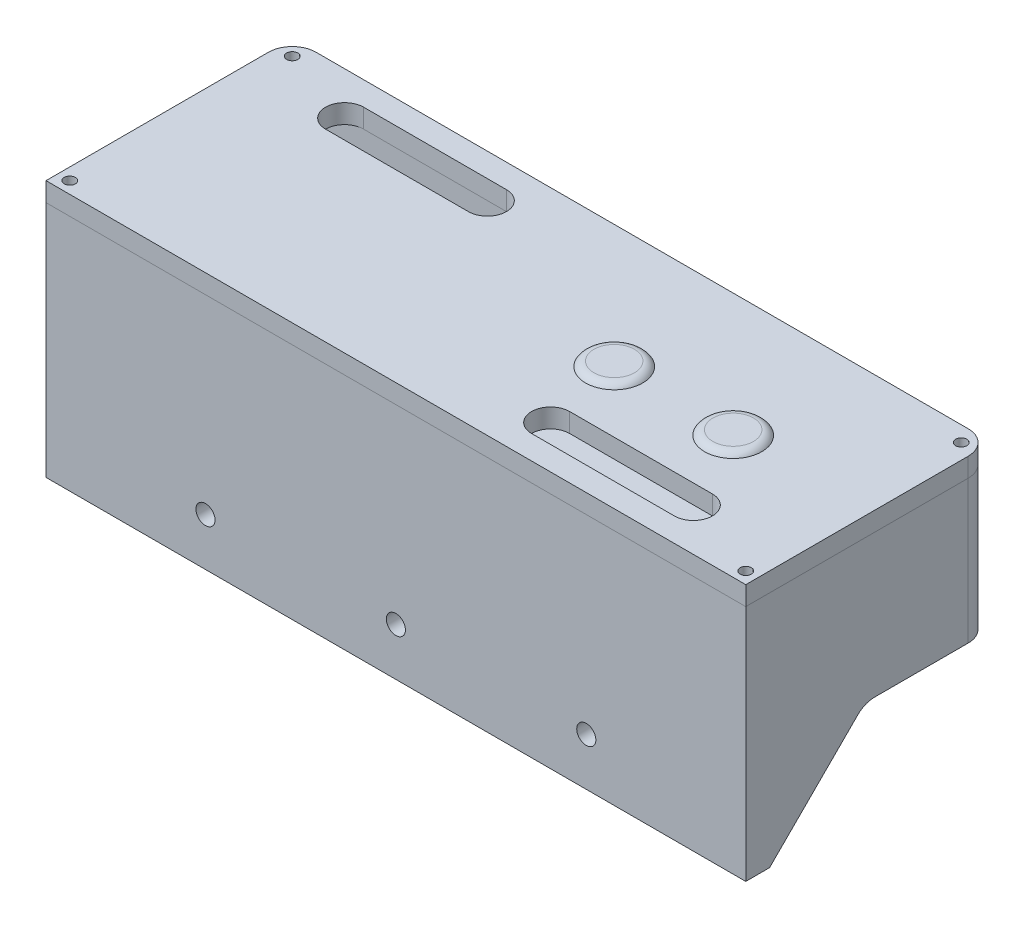
from build123d import *

# Parameters (mm, degrees)
SKETCH1_R             = 1.5
BOSS_EXTRUDE1_DEPTH   = 5.08
SKETCH1_3_R           = 1.5
SKETCH1_3_W           = 174
SKETCH1_3_H           = 53
BOSS_EXTRUDE2_DEPTH   = 38.1
SKETCH3_R             = 1.5
SKETCH3_R_2           = 6.35
BOSS_EXTRUDE4_DEPTH   = 5.08
BOSS_EXTRUDE5_DEPTH   = 25.4
CHAMFER1_SIZE         = 25.4
SKETCH7_R             = 2.55
CUT_EXTRUDE2_DEPTH    = 25.4
SKETCH8_R             = 6.249999997
BOSS_EXTRUDE6_DEPTH   = 2.54
BOSS_EXTRUDE6_2_DEPTH = 2.54
SKETCH8_4_R           = 7.62
SKETCH8_4_R_2         = 6.35
SKETCH8_4_R_3         = 6.249999997
BOSS_EXTRUDE7_DEPTH   = 1.27
FILLET1_R             = 2.54
FILLET2_R             = 2.54
FILLET3_START         = -93.35
FILLET3_DEPTH         = 6.35
FILLET3_START_2       = 87
FILLET3_2_DEPTH       = 6.35


with BuildPart() as part:
    # Sketch1 → Boss-Extrude1 (new body)
    with BuildSketch(Plane(origin=(0, 0, 0), x_dir=(1, 0, 0), z_dir=(0, 1, 0))):
        with BuildLine():
            Line((87, 32.85), (-87, 32.85))
            ThreePointArc((-87, 32.85), (-91.490128061, 30.990128061), (-93.35, 26.5))
            Line((-93.35, 26.5), (-93.35, -1.1))
            Line((-93.35, -1.1), (-87, -1.1))
            Line((-87, -1.1), (-87, -26.5))
            Line((-87, -26.5), (-89.114339828, -28.614339828))
            ThreePointArc((-89.114339828, -28.614339828), (-91.235660172, -28.614339828), (-91.235660172, -30.735660172))
            Line((-91.235660172, -30.735660172), (-93.35, -32.85))
            Line((-93.35, -32.85), (93.35, -32.85))
            Line((93.35, -32.85), (91.235660172, -30.735660172))
            ThreePointArc((91.235660172, -30.735660172), (91.235660172, -28.614339828), (89.114339828, -28.614339828))
            Line((89.114339828, -28.614339828), (87, -26.5))
            Line((87, -26.5), (87, -1.1))
            Line((87, -1.1), (93.35, -1.1))
            Line((93.35, -1.1), (93.35, 26.5))
            ThreePointArc((93.35, 26.5), (91.490128061, 30.990128061), (87, 32.85))
        make_face()
        with Locations(Location((-78.7, 0, 0), (0, 0, 270))):
            Circle(SKETCH1_R, mode=Mode.SUBTRACT)
        with Locations(Location((0, 0, 0), (0, 0, 270))):
            Circle(SKETCH1_R, mode=Mode.SUBTRACT)
        with Locations(Location((78.7, 0, 0), (0, 0, 270))):
            Circle(SKETCH1_R, mode=Mode.SUBTRACT)
    extrude(amount=BOSS_EXTRUDE1_DEPTH)

    # Sketch1<3> → Boss-Extrude2 (add)
    with BuildSketch(Plane(origin=(0, 0, 0), x_dir=(1, 0, 0), z_dir=(0, 1, 0))):
        with BuildLine():
            Line((-87, 32.85), (87, 32.85))
            ThreePointArc((87, 32.85), (91.490128061, 30.990128061), (93.35, 26.5))
            Line((93.35, 26.5), (93.35, -32.85))
            Line((93.35, -32.85), (-93.35, -32.85))
            Line((-93.35, -32.85), (-93.35, 26.5))
            ThreePointArc((-93.35, 26.5), (-91.490128061, 30.990128061), (-87, 32.85))
        make_face()
        with Locations(Location((-89.24506403, 28.74506403, 0), (0, 0, 90))):
            Circle(SKETCH1_3_R, mode=Mode.SUBTRACT)
        with Locations(Location((89.24506403, 28.74506403, 0), (0, 0, 90))):
            Circle(SKETCH1_3_R, mode=Mode.SUBTRACT)
        with Locations(Location((90.175, -29.675, 0), (0, 0, 90))):
            Circle(SKETCH1_3_R, mode=Mode.SUBTRACT)
        with Locations(Location((-90.175, -29.675, 0), (0, 0, 90))):
            Circle(SKETCH1_3_R, mode=Mode.SUBTRACT)
        Rectangle(SKETCH1_3_W, SKETCH1_3_H, mode=Mode.SUBTRACT)
    extrude(amount=BOSS_EXTRUDE2_DEPTH)

    # Sketch1<4> → Boss-Extrude5 (add)
    with BuildSketch(Plane(origin=(0, 0, 0), x_dir=(1, 0, 0), z_dir=(0, 1, 0))):
        Polygon((-87, -26.5), (-87, -1.1), (-93.35, -1.1), (-93.35, -32.85), (93.35, -32.85), (93.35, -1.1), (87, -1.1), (87, -26.5), align=None)
    extrude(amount=-BOSS_EXTRUDE5_DEPTH)

    # Chamfer1
    chamfer1_edges = [part.edges().sort_by_distance(p)[0] for p in [
        (-90.175, -25.4, 1.1),
        (90.175, -25.4, 1.1),
    ]]
    chamfer(chamfer1_edges, length=CHAMFER1_SIZE - 0.0001)  # a hair under: the kernel refuses the full size

    # Sketch7 → Cut-Extrude2 (cut)
    with BuildSketch(Plane(origin=(0, 0, 26.5), x_dir=(-1, 0, 0), z_dir=(0, 0, -1))):
        with Locations((-50.8, -12.7)):
            Circle(SKETCH7_R)
        with Locations((0, -12.7)):
            Circle(SKETCH7_R)
        with Locations((50.8, -12.7)):
            Circle(SKETCH7_R)
    extrude(amount=-CUT_EXTRUDE2_DEPTH, mode=Mode.SUBTRACT)

    # Fillet3: read off the stored shape, not the designer's step
    # Fillet3 outline → Fillet3 (add)
    with BuildSketch(Plane.YZ.offset(FILLET3_START)):
        with BuildLine():
            Line((0, 1.1), (-1.859871939, 2.959871939))
            ThreePointArc((-1.859871939, 2.959871939), (-0.483364969, 0.899783674), (0, -1.530256121))
            Line((0, -1.530256121), (0, 1.1))
        make_face()
    extrude(amount=FILLET3_DEPTH)

    # Fillet3 2 outline → Fillet3 2 (add)
    with BuildSketch(Plane.YZ.offset(FILLET3_START_2)):
        with BuildLine():
            Line((0, 1.1), (-1.859871939, 2.959871939))
            ThreePointArc((-1.859871939, 2.959871939), (-0.483364969, 0.899783674), (0, -1.530256121))
            Line((0, -1.530256121), (0, 1.1))
        make_face()
    extrude(amount=FILLET3_2_DEPTH)


with BuildPart() as body_2:
    # Sketch3 → Boss-Extrude4 (new body)
    with BuildSketch(Plane(origin=(0, 38.1, 0), x_dir=(1, 0, 0), z_dir=(0, 1, 0))):
        with BuildLine():
            Line((87, 32.85), (-87, 32.85))
            ThreePointArc((-87, 32.85), (-91.490128061, 30.990128061), (-93.35, 26.5))
            Line((-93.35, 26.5), (-93.35, -32.85))
            Line((-93.35, -32.85), (93.35, -32.85))
            Line((93.35, -32.85), (93.35, 26.5))
            ThreePointArc((93.35, 26.5), (91.490128061, 30.990128061), (87, 32.85))
        make_face()
        with Locations(Location((-89.24506403, 28.74506403, 0), (0, 0, 270))):
            Circle(SKETCH3_R, mode=Mode.SUBTRACT)
        with Locations(Location((89.24506403, 28.74506403, 0), (0, 0, 270))):
            Circle(SKETCH3_R, mode=Mode.SUBTRACT)
        with Locations(Location((90.175, -29.675, 0), (0, 0, 270))):
            Circle(SKETCH3_R, mode=Mode.SUBTRACT)
        with Locations(Location((-90.175, -29.675, 0), (0, 0, 270))):
            Circle(SKETCH3_R, mode=Mode.SUBTRACT)
        with Locations(Location((25.4, 0, 0), (0, 0, 270))):
            Circle(SKETCH3_R_2, mode=Mode.SUBTRACT)
        with Locations(Location((57.15, 0, 0), (0, 0, 270))):
            Circle(SKETCH3_R_2, mode=Mode.SUBTRACT)
        with BuildLine():
            Line((-67.95, 16.34), (-29.85, 16.34))
            ThreePointArc((-29.85, 16.34), (-24.77, 21.42), (-29.85, 26.5))
            Line((-29.85, 26.5), (-67.95, 26.5))
            ThreePointArc((-67.95, 26.5), (-73.03, 21.42), (-67.95, 16.34))
        make_face(mode=Mode.SUBTRACT)
        with BuildLine():
            Line((67.95, -26.5), (29.85, -26.5))
            ThreePointArc((29.85, -26.5), (24.77, -21.42), (29.85, -16.34))
            Line((29.85, -16.34), (67.95, -16.34))
            ThreePointArc((67.95, -16.34), (73.03, -21.42), (67.95, -26.5))
        make_face(mode=Mode.SUBTRACT)
    extrude(amount=BOSS_EXTRUDE4_DEPTH)


with BuildPart() as body_3:
    # Sketch8 → Boss-Extrude6 (new body)
    with BuildSketch(Plane(origin=(0, 43.18, 0), x_dir=(1, 0, 0), z_dir=(0, 1, 0))):
        with Locations(Location((25.4, 0, 0), (0, 0, 270))):
            Circle(SKETCH8_R)
    extrude(amount=-BOSS_EXTRUDE6_DEPTH)



with BuildPart() as body_4:
    # Sketch8 → Boss-Extrude6 2 (new body)
    with BuildSketch(Plane(origin=(0, 43.18, 0), x_dir=(1, 0, 0), z_dir=(0, 1, 0))):
        with Locations(Location((57.15, 0, 0), (0, 0, 270))):
            Circle(SKETCH8_R)
    extrude(amount=-BOSS_EXTRUDE6_2_DEPTH)


with BuildPart() as body_3_1:
    add(body_3.part)

    add(body_4.part)  # Boss-Extrude7 merges body 4
    # Sketch8<4> → Boss-Extrude7 (add)
    # profile 1 of 6: a face of its own
    with BuildSketch(Plane(origin=(0, 43.18, 0), x_dir=(1, 0, 0), z_dir=(0, 1, 0))):
        with Locations(Location((25.4, 0, 0), (0, 0, 270))):
            Circle(SKETCH8_4_R)
        with Locations(Location((25.4, 0, 0), (0, 0, 270))):
            Circle(SKETCH8_4_R_2, mode=Mode.SUBTRACT)
    # profile 2 of 6: a face of its own
    with BuildSketch(Plane(origin=(0, 43.18, 0), x_dir=(1, 0, 0), z_dir=(0, 1, 0))):
        with Locations(Location((57.15, 0, 0), (0, 0, 270))):
            Circle(SKETCH8_4_R)
        with Locations(Location((57.15, 0, 0), (0, 0, 270))):
            Circle(SKETCH8_4_R_2, mode=Mode.SUBTRACT)
    # profile 3 of 6: a face of its own
    with BuildSketch(Plane(origin=(0, 43.18, 0), x_dir=(1, 0, 0), z_dir=(0, 1, 0))):
        with Locations(Location((25.4, 0, 0), (0, 0, 270))):
            Circle(SKETCH8_4_R_2)
        with Locations(Location((25.4, 0, 0), (0, 0, 270))):
            Circle(SKETCH8_4_R_3, mode=Mode.SUBTRACT)
    # profile 4 of 6: a face of its own
    with BuildSketch(Plane(origin=(0, 43.18, 0), x_dir=(1, 0, 0), z_dir=(0, 1, 0))):
        with Locations(Location((25.4, 0, 0), (0, 0, 270))):
            Circle(SKETCH8_4_R_3)
    # profile 5 of 6: a face of its own
    with BuildSketch(Plane(origin=(0, 43.18, 0), x_dir=(1, 0, 0), z_dir=(0, 1, 0))):
        with Locations(Location((57.15, 0, 0), (0, 0, 270))):
            Circle(SKETCH8_4_R_2)
        with Locations(Location((57.15, 0, 0), (0, 0, 270))):
            Circle(SKETCH8_4_R_3, mode=Mode.SUBTRACT)
    # profile 6 of 6: a face of its own
    with BuildSketch(Plane(origin=(0, 43.18, 0), x_dir=(1, 0, 0), z_dir=(0, 1, 0))):
        with Locations(Location((57.15, 0, 0), (0, 0, 270))):
            Circle(SKETCH8_4_R_3)
    extrude(amount=BOSS_EXTRUDE7_DEPTH)

    # Fillet1
    # the kernel refuses this fillet: 2.54 mm, written as the material it takes off along each edge
    with BuildSketch(Plane(origin=(25.4, 44.45, 0), x_dir=(0, 0, 1), z_dir=(-1, 0, 0))) as fillet1_piece_1:
        with BuildLine():
            CenterArc((5.420295474, -2.54), FILLET1_R, 30, 60)
            Line((5.420295474, 0), (5.420295474, 0.0508))
            Line((5.420295474, 0.0508), (7.62, 0.0508))
            Line((7.62, 0.0508), (7.6708, 0))
            ThreePointArc((7.6708, 0), (7.6708, -0.635), (7.663994091, -1.2446))
            Line((7.663994091, -1.2446), (7.62, -1.27))
        make_face()
    revolve(axis=Axis((25.4, 44.45, 0), (0, 1, 0)), mode=Mode.SUBTRACT)

    # Fillet2
    # the kernel refuses this fillet: 2.54 mm, written as the material it takes off along each edge
    with BuildSketch(Plane(origin=(57.15, 44.45, 0), x_dir=(0, 0, 1), z_dir=(-1, 0, 0))) as fillet2_piece_1:
        with BuildLine():
            CenterArc((5.420295474, -2.54), FILLET2_R, 30, 60)
            Line((5.420295474, 0), (5.420295474, 0.0508))
            Line((5.420295474, 0.0508), (7.62, 0.0508))
            Line((7.62, 0.0508), (7.6708, 0))
            ThreePointArc((7.6708, 0), (7.6708, -0.635), (7.663994091, -1.2446))
            Line((7.663994091, -1.2446), (7.62, -1.27))
        make_face()
    revolve(axis=Axis((57.15, 44.45, 0), (0, 1, 0)), mode=Mode.SUBTRACT)


solid = Compound([part.part, body_2.part, body_3_1.part])
